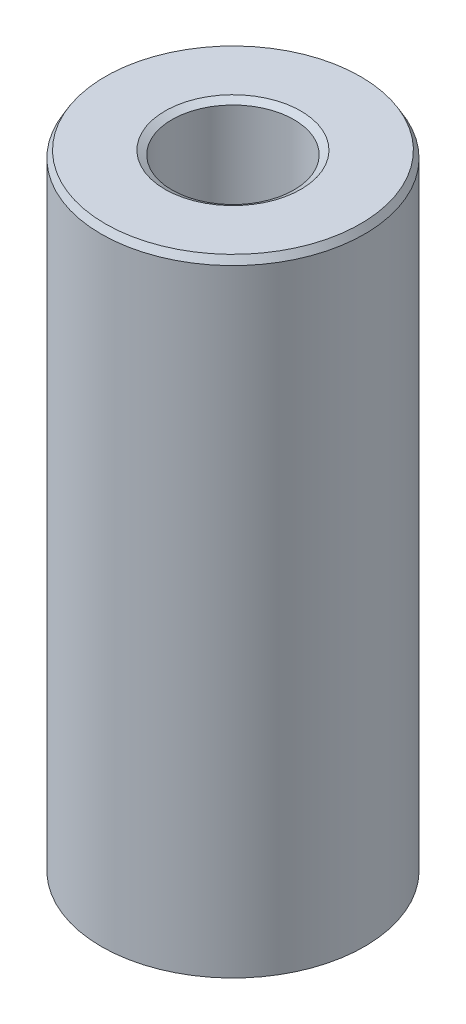
from build123d import *
from OCP.BRepFilletAPI import BRepFilletAPI_MakeChamfer

# Parameters (mm, degrees)
SKETCH1_R           = 42.5
BOSS_EXTRUDE1_DEPTH = 202.766005469
SKETCH2_R           = 19.698354179
CUT_EXTRUDE1_DEPTH  = 212.486531424
CHAMFER1_SIZE       = 2.237072489
CHAMFER1_SIZE2      = 1.291574404


with BuildPart() as part:
    # Sketch1 → Boss-Extrude1 (new body)
    with BuildSketch(Plane(origin=(0, 0, 0), x_dir=(1, 0, 0), z_dir=(0, 1, 0))):
        Circle(SKETCH1_R)
    extrude(amount=BOSS_EXTRUDE1_DEPTH)

    # Sketch2 → Cut-Extrude1 (cut, through all)
    with BuildSketch(Plane(origin=(0, 0, 0), x_dir=(1, 0, 0), z_dir=(0, 1, 0))):
        Circle(SKETCH2_R)
    extrude(amount=CUT_EXTRUDE1_DEPTH, mode=Mode.SUBTRACT)

    # Chamfer1: one chamfer whose edges measure the first distance from different faces: ONE call of the kernel's chamfer builder (chamfer() names one face for all edges)
    chamfer1_edges_1 = [part.edges().sort_by_distance(p)[0] for p in [
        (-19.698354179, 202.766005469, 0),
    ]]
    chamfer1_side_1 = [part.faces().sort_by_distance(p)[0] for p in [
        (-41.297918472, 202.766005469, 0),
    ]]
    chamfer1_edges_2 = [part.edges().sort_by_distance(p)[0] for p in [
        (-19.698354179, 0, 0),
    ]]
    chamfer1_side_2 = [part.faces().sort_by_distance(p)[0] for p in [
        (-19.698354179, 101.383002734, 0),
    ]]
    chamfer1_edges_3 = [part.edges().sort_by_distance(p)[0] for p in [
        (-42.5, 0, 0),
    ]]
    chamfer1_side_3 = [part.faces().sort_by_distance(p)[0] for p in [
        (-41.297918472, 0, 0),
    ]]
    chamfer1_edges_4 = [part.edges().sort_by_distance(p)[0] for p in [
        (-42.5, 202.766005469, 0),
    ]]
    chamfer1_side_4 = [part.faces().sort_by_distance(p)[0] for p in [
        (-42.5, 101.383002734, 0),
    ]]
    chamfer1 = BRepFilletAPI_MakeChamfer(part.part.solid().wrapped)
    for e in chamfer1_edges_1:
        chamfer1.Add(CHAMFER1_SIZE, CHAMFER1_SIZE2, e.wrapped, chamfer1_side_1[0].wrapped)  # the first distance lies on this face
    for e in chamfer1_edges_2:
        chamfer1.Add(CHAMFER1_SIZE, CHAMFER1_SIZE2, e.wrapped, chamfer1_side_2[0].wrapped)  # the first distance lies on this face
    for e in chamfer1_edges_3:
        chamfer1.Add(CHAMFER1_SIZE, CHAMFER1_SIZE2, e.wrapped, chamfer1_side_3[0].wrapped)  # the first distance lies on this face
    for e in chamfer1_edges_4:
        chamfer1.Add(CHAMFER1_SIZE, CHAMFER1_SIZE2, e.wrapped, chamfer1_side_4[0].wrapped)  # the first distance lies on this face
    add(Compound.cast(chamfer1.Shape()), mode=Mode.REPLACE)


solid = part.part
